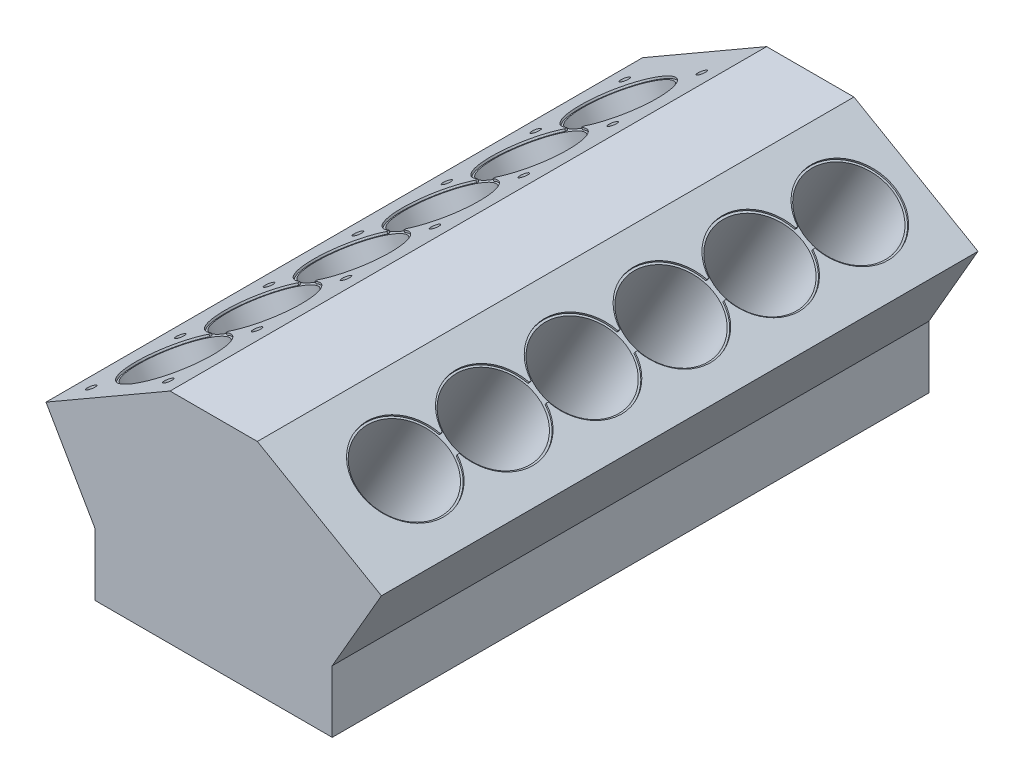
from build123d import *

# Parameters (mm, degrees)
BOSS_EXTRUDE1_DEPTH        = 302
SKETCH2_R                  = 43
CUT_EXTRUDE1_DEPTH         = 154
SKETCH3_R                  = 43
CUT_EXTRUDE2_DEPTH         = 154
LPATTERN1_COUNT            = 6
LPATTERN1_PITCH            = 90
CUT_EXTRUDE4_DEPTH         = 2
CUT_EXTRUDE5_DEPTH         = 2
M10X1_0_TAPPED_HOLE1_D     = 9
M10X1_0_TAPPED_HOLE1_DEPTH = 47
M10X1_0_TAPPED_HOLE1_TIP   = 2.703872786


with BuildPart() as part:
    # Sketch1 → Boss-Extrude1 (new, symmetric)
    with BuildSketch(Plane.XY):
        Polygon((0, 0), (120, 0), (120, 62.846096908), (169.786841774, 149.07943641), (44.213158226, 221.57943641), (0, 221.57943641), align=None)
    extrude(amount=BOSS_EXTRUDE1_DEPTH, both=True)

    # Mirror1: part across plane


with BuildPart() as part_1:
    add(part.part)
    add(part.part.mirror(Plane(origin=(0, 0, 0), x_dir=(0, 0, 1), z_dir=(1, 0, 0))))

    # Sketch2 → Cut-Extrude1 (cut)
    with BuildSketch(Plane(origin=(-107, 185.32943641, 0), x_dir=(-0.8660254037844382, -0.5000000000000009, 0), z_dir=(0.5000000000000009, -0.8660254037844383, 0))):
        with Locations((0, 215)):
            Circle(SKETCH2_R)
    cut_extrude1 = extrude(amount=CUT_EXTRUDE1_DEPTH, mode=Mode.SUBTRACT)

    # Sketch3 → Cut-Extrude2 (cut)
    with BuildSketch(Plane(origin=(107, 185.32943641, 0), x_dir=(0.8660254037844382, -0.5000000000000009, 0), z_dir=(0.5000000000000009, 0.8660254037844383, 0))):
        with Locations((0, 235)):
            Circle(SKETCH3_R)
    cut_extrude2 = extrude(amount=-CUT_EXTRUDE2_DEPTH, mode=Mode.SUBTRACT)

    # LPattern1: Cut-Extrude1, Cut-Extrude2 ×6
    with Locations(*[(0, 0, i * LPATTERN1_PITCH) for i in range(1, LPATTERN1_COUNT)]):
        add(cut_extrude1, mode=Mode.SUBTRACT)
        add(cut_extrude2, mode=Mode.SUBTRACT)

    # Sketch4 → Cut-Extrude4 (cut)
    with BuildSketch(Plane(origin=(-107, 185.32943641, 0), x_dir=(0.8660254037844382, 0.5000000000000009, 0), z_dir=(-0.5000000000000009, 0.8660254037844383, 0))):
        with BuildLine():
            Line((-10, 171.125178063), (-10, 168.919134034))
            ThreePointArc((-10, 168.919134034), (-45.229891353, 124.992547813), (-10, 81.065961592))
            Line((-10, 81.065961592), (-10, 78.90454927))
            ThreePointArc((-10, 78.90454927), (-45.164441141, 34.992571611), (-10, -8.919406048))
            Line((-10, -8.919406048), (-10, -11.11013794))
            ThreePointArc((-10, -11.11013794), (-45.09899093, -55.00740459), (-10, -98.904671241))
            Line((-10, -98.904671241), (-10, -101.146617341))
            ThreePointArc((-10, -101.146617341), (-44.938517527, -145.007380792), (-10, -188.868144242))
            Line((-10, -188.868144242), (-10, -191.139831299))
            ThreePointArc((-10, -191.139831299), (0, -279.985713271), (10, -191.139831299))
            Line((10, -191.139831299), (10, -188.896170583))
            ThreePointArc((10, -188.896170583), (45.061482473, -145.007380792), (10, -101.118591))
            Line((10, -101.118591), (10, -98.859546866))
            ThreePointArc((10, -98.859546866), (44.90100907, -55.00740459), (10, -11.155262314))
            Line((10, -11.155262314), (10, -8.844446265))
            ThreePointArc((10, -8.844446265), (44.835558859, 34.992571611), (10, 78.829589488))
            Line((10, 78.829589488), (10, 81.17075731))
            ThreePointArc((10, 81.17075731), (44.770108647, 124.992547813), (10, 168.814338316))
            Line((10, 168.814338316), (10, 171.125178063))
            ThreePointArc((10, 171.125178063), (0, 260), (-10, 171.125178063))
        make_face()
    extrude(amount=-CUT_EXTRUDE4_DEPTH, mode=Mode.SUBTRACT)

    # Sketch6 → Cut-Extrude5 (cut)
    with BuildSketch(Plane(origin=(107, 185.32943641, 0), x_dir=(0.8660254037844382, -0.5000000000000009, 0), z_dir=(0.5000000000000009, 0.8660254037844383, 0))):
        with BuildLine():
            Line((-10, 191.125178063), (-10, 188.919134034))
            ThreePointArc((-10, 188.919134034), (-45.229891353, 144.992547813), (-10, 101.065961592))
            Line((-10, 101.065961592), (-10, 98.90454927))
            ThreePointArc((-10, 98.90454927), (-45.164441141, 54.992571611), (-10, 11.080593952))
            Line((-10, 11.080593952), (-10, 8.88986206))
            ThreePointArc((-10, 8.88986206), (-45.09899093, -35.00740459), (-10, -78.904671241))
            Line((-10, -78.904671241), (-10, -81.146617341))
            ThreePointArc((-10, -81.146617341), (-44.938517527, -125.007380792), (-10, -168.868144242))
            Line((-10, -168.868144242), (-10, -171.139831299))
            ThreePointArc((-10, -171.139831299), (0, -259.985713271), (10, -171.139831299))
            Line((10, -171.139831299), (10, -168.896170583))
            ThreePointArc((10, -168.896170583), (45.061482473, -125.007380792), (10, -81.118591))
            Line((10, -81.118591), (10, -78.859546866))
            ThreePointArc((10, -78.859546866), (44.90100907, -35.00740459), (10, 8.844737686))
            Line((10, 8.844737686), (10, 11.155553735))
            ThreePointArc((10, 11.155553735), (44.835558859, 54.992571611), (10, 98.829589488))
            Line((10, 98.829589488), (10, 101.17075731))
            ThreePointArc((10, 101.17075731), (44.770108647, 144.992547813), (10, 188.814338316))
            Line((10, 188.814338316), (10, 191.125178063))
            ThreePointArc((10, 191.125178063), (0, 280), (-10, 191.125178063))
        make_face()
    extrude(amount=-CUT_EXTRUDE5_DEPTH, mode=Mode.SUBTRACT)

    # M10x1.0 Tapped Hole1
    with Locations(Plane(origin=(-107, 185.32943641, 0), x_dir=(0.8660254037844382, 0.5000000000000009, 0), z_dir=(-0.5000000000000009, 0.8660254037844383, 0))):
        with Locations((45, 260), (-45, 260), (45, 170), (-45, 170), (45, 80), (-45, 80), (45, -10), (-45, -10), (45, -100), (-45, -100), (45, -190), (-45, -190), (45, -280), (-45, -280)):
            Hole(M10X1_0_TAPPED_HOLE1_D / 2, depth=M10X1_0_TAPPED_HOLE1_DEPTH)
            with Locations((0, 0, -(M10X1_0_TAPPED_HOLE1_DEPTH + M10X1_0_TAPPED_HOLE1_TIP / 2))):  # 118° drill point
                Cone(0, M10X1_0_TAPPED_HOLE1_D / 2, M10X1_0_TAPPED_HOLE1_TIP, mode=Mode.SUBTRACT)


solid = part_1.part
